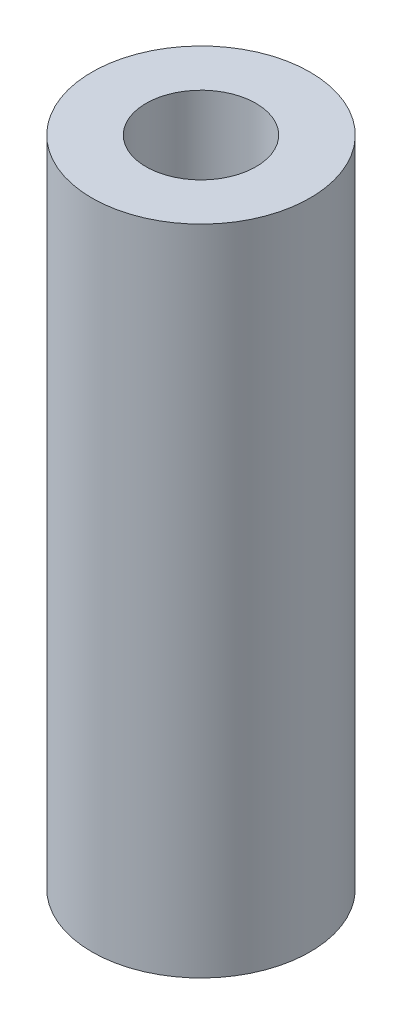
from build123d import *

# Parameters (mm, degrees)
SKETCH1_R           = 4.7625
SKETCH1_R_2         = 2.4
BOSS_EXTRUDE1_DEPTH = 14.25


with BuildPart() as part:
    # Sketch1 → Boss-Extrude1 (new, symmetric)
    with BuildSketch(Plane(origin=(0, 0, 0), x_dir=(1, 0, 0), z_dir=(0, 1, 0))):
        Circle(SKETCH1_R)
        Circle(SKETCH1_R_2, mode=Mode.SUBTRACT)
    extrude(amount=BOSS_EXTRUDE1_DEPTH, both=True)


solid = part.part
